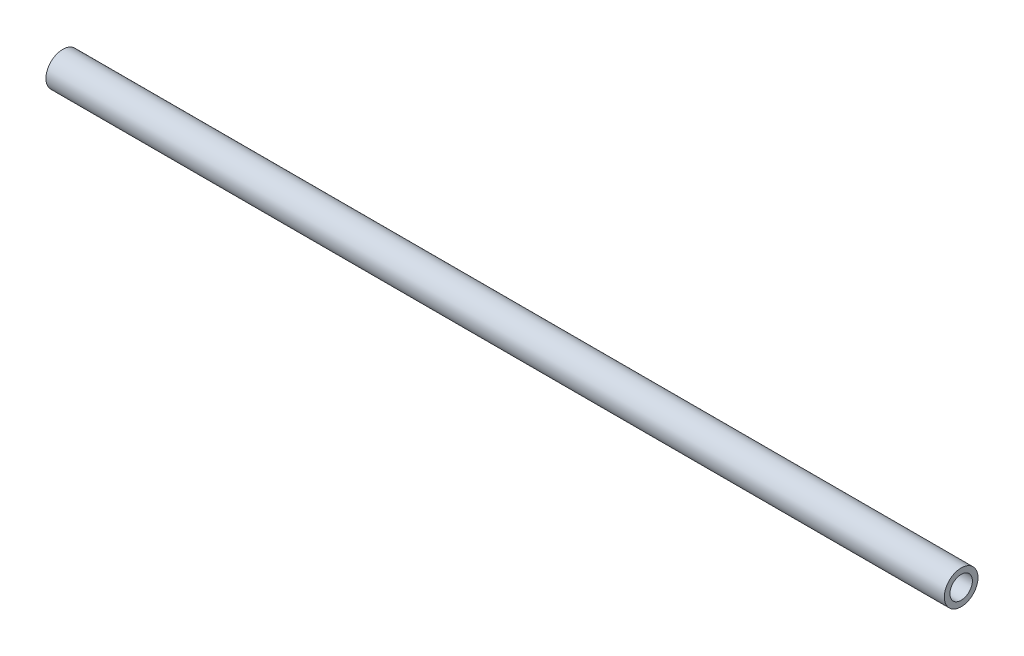
from build123d import *

# Parameters (mm, degrees)
SKETCH1_R           = 9.525
SKETCH1_R_2         = 6.35
BOSS_EXTRUDE1_DEPTH = 508


with BuildPart() as part:
    # Sketch1 → Boss-Extrude1 (new body)
    with BuildSketch(Plane(origin=(0, 0, 0), x_dir=(0, 0, -1), z_dir=(1, 0, 0))):
        Circle(SKETCH1_R)
        Circle(SKETCH1_R_2, mode=Mode.SUBTRACT)
    extrude(amount=BOSS_EXTRUDE1_DEPTH)


solid = part.part
